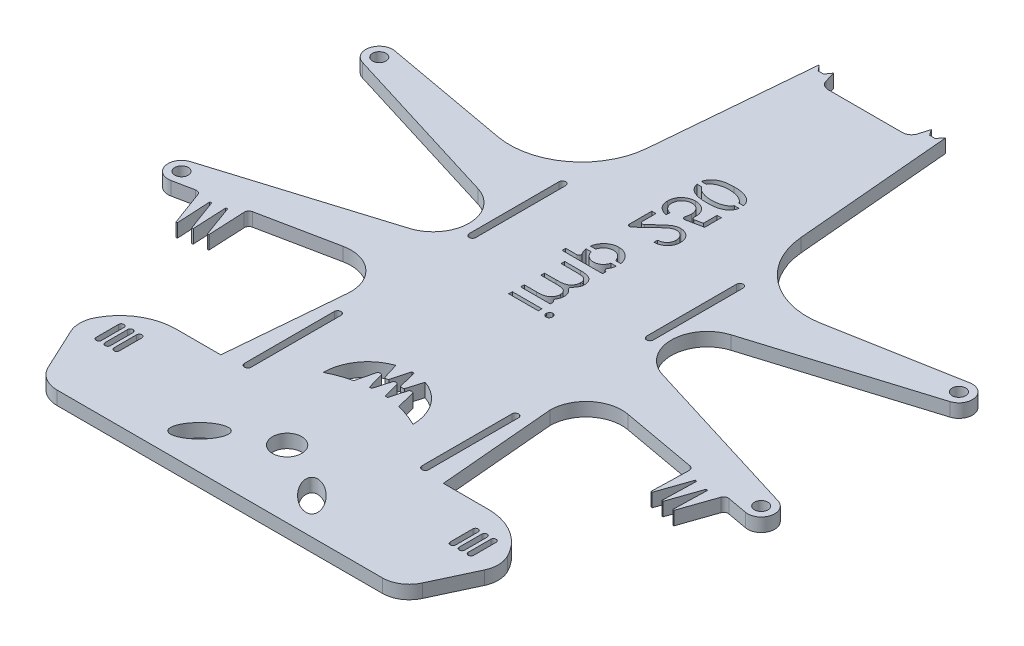
from build123d import *

# Parameters (mm, degrees)
SKETCH_1_R          = 1.5
SKETCH_1_R_2        = 25
SKETCH_1_R_3        = 1
EXTRUDE_1_DEPTH     = 3
CUT_EXTRUDE_1_DEPTH = 3
EXTRUDE_2_DEPTH     = 3
CUT_EXTRUDE_2_DEPTH = 3
SKETCH_6_R          = 3
EXTRUDE_3_DEPTH     = 3
EXTRUDE_4_DEPTH     = 3
CUT_EXTRUDE_3_DEPTH = 10
SKETCH_10_R         = 3.25
EXTRUDE_5_DEPTH     = 3
SKETCH_12_R         = 3.25
SKETCH_12_RX        = 5
SKETCH_12_RY        = 2.25
CUT_EXTRUDE_4_DEPTH = 3
SKETCH_13_W         = 6.576923077
SKETCH_13_H         = 0.807692307
CUT_EXTRUDE_6_DEPTH = 3
EXTRUDE_6_DEPTH     = 3
FILLET_1_R          = 1
FILLET_2_R          = 1
FILLET_3_R          = 1
FILLET_4_R          = 1
FILLET_5_R          = 0.5
FILLET_6_R          = 0.5
FILLET_7_R          = 0.5
FILLET_8_R          = 0.5
FILLET_9_R          = 0.5
FILLET_10_R         = 0.5
FILLET_11_R         = 0.5
FILLET_12_R         = 0.5


with BuildPart() as part:
    # 草图1 → 凸台-拉伸1 (new body)
    with BuildSketch(Plane(origin=(0, 0, 0), x_dir=(1, 0, 0), z_dir=(0, 1, 0))):
        with BuildLine():
            Line((-65.384333619, -19.133302588), (-28.141777015, -7.644526431))
            ThreePointArc((-28.141777015, -7.644526431), (-22.5, 0), (-28.141777015, 7.644526431))
            Line((-28.141777015, 7.644526431), (-65.384333619, 19.133302588))
            ThreePointArc((-65.384333619, 19.133302588), (-67.41435877, 22.711697239), (-63.963475544, 24.951633702))
            Line((-63.963475544, 24.951633702), (-35.956989403, 19.860837807))
            ThreePointArc((-35.956989403, 19.860837807), (-23.387681178, 22.884481961), (-17.156151846, 34.211351583))
            Line((-17.156151846, 34.211351583), (-14.077866308, 69.471713196))
            Line((-14.077866308, 69.471713196), (-13, 68.181117341))
            Line((-13, 68.181117341), (-11.8, 68.181117341))
            Line((-11.8, 68.181117341), (-10.884480237, 69.471713196))
            Line((-10.884480237, 69.471713196), (-10.181933712, 67.110709467))
            ThreePointArc((-10.181933712, 67.110709467), (-9.460655522, 66.077868179), (-8.265, 65.681117341))
            Line((-8.265, 65.681117341), (8.265, 65.681117341))
            ThreePointArc((8.265, 65.681117341), (9.462435388, 66.079197089), (10.183195998, 67.114968849))
            Line((10.183195998, 67.114968849), (10.878780421, 69.471713196))
            Line((10.878780421, 69.471713196), (11.8, 68.181117341))
            Line((11.8, 68.181117341), (13, 68.181117341))
            Line((13, 68.181117341), (14.077866308, 69.471713196))
            Line((14.077866308, 69.471713196), (17.156151846, 34.211351583))
            ThreePointArc((17.156151846, 34.211351583), (23.387681178, 22.884481961), (35.956989403, 19.860837807))
            Line((35.956989403, 19.860837807), (63.963475544, 24.951633702))
            ThreePointArc((63.963475544, 24.951633702), (67.41435877, 22.711697239), (65.384333619, 19.133302588))
            Line((65.384333619, 19.133302588), (28.141777015, 7.644526431))
            ThreePointArc((28.141777015, 7.644526431), (22.5, 0), (28.141777015, -7.644526431))
            Line((28.141777015, -7.644526431), (65.384333619, -19.133302588))
            ThreePointArc((65.384333619, -19.133302588), (67.41435877, -22.711697239), (63.963475544, -24.951633702))
            Line((63.963475544, -24.951633702), (58.589986972, -23.974883765))
            Line((58.589986972, -23.974883765), (55.61845735, -32.558811532))
            ThreePointArc((55.61845735, -32.558811532), (55.466756874, -32.55464441), (55.323293979, -32.505159086))
            Line((55.323293979, -32.505159086), (55.521561464, -24.98413568))
            ThreePointArc((55.521561464, -24.98413568), (55.332251162, -24.907297928), (55.128010304, -24.912599086))
            Line((55.128010304, -24.912599086), (52.666823648, -32.022287076))
            ThreePointArc((52.666823648, -32.022287076), (52.515123172, -32.018119954), (52.371660278, -31.968634631))
            Line((52.371660278, -31.968634631), (52.569927762, -24.447611224))
            ThreePointArc((52.569927762, -24.447611224), (52.38061746, -24.370773472), (52.176376602, -24.37607463))
            Line((52.176376602, -24.37607463), (49.715189946, -31.485762621))
            ThreePointArc((49.715189946, -31.485762621), (49.56348947, -31.481595499), (49.420026576, -31.432110175))
            Line((49.420026576, -31.432110175), (49.659406105, -22.351553934))
            Line((49.659406105, -22.351553934), (31.930731882, -19.128976796))
            ThreePointArc((31.930731882, -19.128976796), (25.373883295, -20.858100658), (22.5, -27))
            Line((22.5, -27), (28, -90))
            Line((28, -90), (28, -109.5))
            ThreePointArc((28, -109.5), (24.924621202, -116.924621202), (17.5, -120))
            Line((17.5, -120), (-17.5, -120))
            ThreePointArc((-17.5, -120), (-24.924621202, -116.924621202), (-28, -109.5))
            Line((-28, -109.5), (-28, -90))
            Line((-28, -90), (-22.5, -27))
            ThreePointArc((-22.5, -27), (-25.142969185, -20.335475151), (-32.064056542, -18.464719321))
            Line((-32.064056542, -18.464719321), (-49.692991602, -22.050022904))
            Line((-49.692991602, -22.050022904), (-49.264522073, -31.123622966))
            ThreePointArc((-49.264522073, -31.123622966), (-49.406923097, -31.17608579), (-49.558503862, -31.183411827))
            Line((-49.558503862, -31.183411827), (-52.129558212, -24.118866271))
            ThreePointArc((-52.129558212, -24.118866271), (-52.333865179, -24.117820464), (-52.52153393, -24.198584753))
            Line((-52.52153393, -24.198584753), (-52.166651557, -31.713846663))
            ThreePointArc((-52.166651557, -31.713846663), (-52.30905258, -31.766309487), (-52.460633345, -31.773635525))
            Line((-52.460633345, -31.773635525), (-55.069376098, -24.716754888))
            ThreePointArc((-55.069376098, -24.716754888), (-55.273683065, -24.715709081), (-55.461351816, -24.79647337))
            Line((-55.461351816, -24.79647337), (-55.06878104, -32.304070361))
            ThreePointArc((-55.06878104, -32.304070361), (-55.211182063, -32.356533185), (-55.362762829, -32.363859222))
            Line((-55.362762829, -32.363859222), (-58.512445259, -23.843688755))
            Line((-58.512445259, -23.843688755), (-63.902111383, -24.939817886))
            ThreePointArc((-63.902111383, -24.939817886), (-67.406788203, -22.742012359), (-65.384333619, -19.133302588))
        make_face()
        with Locations(Location((-64.5, 22, 0), (0, 0, 270))):
            Circle(SKETCH_1_R, mode=Mode.SUBTRACT)
        with Locations(Location((64.5, 22, 0), (0, 0, 90))):
            Circle(SKETCH_1_R, mode=Mode.SUBTRACT)
        with Locations(Location((64.5, -22, 0), (0, 0, 270))):
            Circle(SKETCH_1_R, mode=Mode.SUBTRACT)
        with Locations(Location((-64.5, -22, 0), (0, 0, 90))):
            Circle(SKETCH_1_R, mode=Mode.SUBTRACT)
        with Locations(Location((0, -90, 0), (0, 0, 270))):
            Circle(SKETCH_1_R_2, mode=Mode.SUBTRACT)
        with Locations(Location((-15, -65, 0), (0, 0, 270))):
            Circle(SKETCH_1_R_3, mode=Mode.SUBTRACT)
        with Locations(Location((15, -65, 0), (0, 0, 270))):
            Circle(SKETCH_1_R_3, mode=Mode.SUBTRACT)
        with Locations(Location((-15.42, -115, 0), (0, 0, 270))):
            Circle(SKETCH_1_R_3, mode=Mode.SUBTRACT)
        with Locations(Location((17.43, -115, 0), (0, 0, 270))):
            Circle(SKETCH_1_R_3, mode=Mode.SUBTRACT)
    extrude(amount=EXTRUDE_1_DEPTH)

    # 草图2 → 切除-拉伸1 (cut)
    with BuildSketch(Plane.XZ):
        with BuildLine():
            Line((-19, 2), (-19, -18))
            ThreePointArc((-19, -18), (-19.75, -18.75), (-20.5, -18))
            Line((-20.5, -18), (-20.5, 2))
            ThreePointArc((-20.5, 2), (-19.75, 2.75), (-19, 2))
        make_face()
        with BuildLine():
            Line((20.5, 2), (20.5, -18))
            ThreePointArc((20.5, -18), (19.75, -18.75), (19, -18))
            Line((19, -18), (19, 2))
            ThreePointArc((19, 2), (19.75, 2.75), (20.5, 2))
        make_face()
        with BuildLine():
            Line((-19, 52), (-19, 32))
            ThreePointArc((-19, 32), (-19.75, 31.25), (-20.5, 32))
            Line((-20.5, 32), (-20.5, 52))
            ThreePointArc((-20.5, 52), (-19.75, 52.75), (-19, 52))
        make_face()
        with BuildLine():
            Line((20.5, 52), (20.5, 32))
            ThreePointArc((20.5, 32), (19.75, 31.25), (19, 32))
            Line((19, 32), (19, 52))
            ThreePointArc((19, 52), (19.75, 52.75), (20.5, 52))
        make_face()
        with BuildLine():
            ThreePointArc((-10, 45), (0, 35), (10, 45))
            ThreePointArc((10, 45), (0, 42.595917942), (-10, 45))
        make_face()
    extrude(amount=-CUT_EXTRUDE_1_DEPTH, mode=Mode.SUBTRACT)

    # 草图3 → 凸台-拉伸2 (add)
    with BuildSketch(Plane.XZ):
        with BuildLine():
            Line((-1.5, 42.647113875), (-0.445421149, 38.96))
            ThreePointArc((-0.445421149, 38.96), (0, 38.8), (0.445421149, 38.96))
            Line((0.445421149, 38.96), (1.5, 42.647113875))
            Line((1.5, 42.647113875), (1.5, 43.687015642))
            Line((1.5, 43.687015642), (2, 43.687015642))
            Line((2, 43.687015642), (2, 42.687015642))
            Line((2, 42.687015642), (3.054578851, 38.96))
            ThreePointArc((3.054578851, 38.96), (3.5, 38.8), (3.945421149, 38.96))
            Line((3.945421149, 38.96), (5, 43.171632657))
            Line((5, 43.171632657), (5, 44.171632657))
            Line((5, 44.171632657), (-5, 44.171632657))
            Line((-5, 44.171632657), (-5, 43.171632657))
            Line((-5, 43.171632657), (-3.945421149, 38.96))
            ThreePointArc((-3.945421149, 38.96), (-3.5, 38.8), (-3.054578851, 38.96))
            Line((-3.054578851, 38.96), (-2, 42.687015642))
            Line((-2, 42.687015642), (-2, 43.687015642))
            Line((-2, 43.687015642), (-1.5, 43.687015642))
            Line((-1.5, 43.687015642), (-1.5, 42.647113875))
        make_face()
        with BuildLine():
            Line((-1.304578851, 39.04), (-0.25, 35.003125488))
            Line((-0.25, 35.003125488), (-0.25, 34.003125488))
            Line((-0.25, 34.003125488), (0.25, 34.003125488))
            Line((0.25, 34.003125488), (0.25, 35.003125488))
            Line((0.25, 35.003125488), (1.304578851, 39.04))
            ThreePointArc((1.304578851, 39.04), (1.75, 39.2), (2.195421149, 39.04))
            Line((2.195421149, 39.04), (3.25, 35.54285984))
            Line((3.25, 35.54285984), (3.25, 33.54285984))
            Line((3.25, 33.54285984), (-3.25, 33.54285984))
            Line((-3.25, 33.54285984), (-3.25, 35.54285984))
            Line((-3.25, 35.54285984), (-2.190592727, 39.043946734))
            ThreePointArc((-2.190592727, 39.043946734), (-1.746881893, 39.199993055), (-1.304578851, 39.04))
        make_face()
    extrude(amount=-EXTRUDE_2_DEPTH)

    # 草图4 → 切除-拉伸2 (cut)
    with BuildSketch(Plane.XZ):
        with BuildLine():
            Line((-28, 108), (-21.44761059, 108))
            ThreePointArc((-21.44761059, 108), (-26.31095871, 99.57775818), (-28, 90))
            Line((-28, 90), (-28, 108))
        make_face()
        with BuildLine():
            Line((-21.44761059, 113), (-21.44761059, 119.229664467))
            ThreePointArc((-21.44761059, 119.229664467), (-25.091953813, 116.753429347), (-27.399494937, 113))
            Line((-27.399494937, 113), (-21.44761059, 113))
        make_face()
        with BuildLine():
            Line((21.44761059, 119.229664467), (21.44761059, 113))
            Line((21.44761059, 113), (27.399494937, 113))
            ThreePointArc((27.399494937, 113), (25.091953813, 116.753429347), (21.44761059, 119.229664467))
        make_face()
        with BuildLine():
            Line((21.44761059, 108), (28, 108))
            Line((28, 108), (28, 90))
            ThreePointArc((28, 90), (26.31095871, 99.57775818), (21.44761059, 108))
        make_face()
    extrude(amount=-CUT_EXTRUDE_2_DEPTH, mode=Mode.SUBTRACT)

    # 草图6 → 凸台-拉伸3 (add)
    with BuildSketch(Plane.XZ):
        Polygon((-21.44761059, 119.229664467), (-21.44761059, 139), (-18.44761059, 142), (18.44761059, 142), (21.44761059, 139), (21.44761059, 119.229664467), align=None)
        with Locations(Location((0, 131, 0), (0, 0, 270))):
            Circle(SKETCH_6_R, mode=Mode.SUBTRACT)
    extrude(amount=-EXTRUDE_3_DEPTH)

    # 草图7 → 凸台-拉伸4 (add)
    with BuildSketch(Plane.XZ):
        with BuildLine():
            Line((-26.611915935, 74.100127979), (-28, 90))
            ThreePointArc((-28, 90), (-26.31095871, 99.57775818), (-21.44761059, 108))
            Line((-21.44761059, 108), (-25.238858928, 108))
            ThreePointArc((-25.238858928, 108), (-30.974603213, 91.254573939), (-26.611915935, 74.100127979))
        make_face()
        with BuildLine():
            Line((28, 90), (26.611915935, 74.100127979))
            ThreePointArc((26.611915935, 74.100127979), (30.974603213, 91.254573939), (25.238858928, 108))
            Line((25.238858928, 108), (21.44761059, 108))
            ThreePointArc((21.44761059, 108), (26.31095871, 99.57775818), (28, 90))
        make_face()
    extrude(amount=-EXTRUDE_4_DEPTH)

    # 草图8 → 切除-拉伸3 (cut)
    with BuildSketch(Plane.XZ):
        with BuildLine():
            Line((-25.642857143, 63), (-26.611915935, 74.100127979))
            ThreePointArc((-26.611915935, 74.100127979), (-30.974603213, 91.254573939), (-25.238858928, 108))
            Line((-25.238858928, 108), (-28, 108))
            Line((-28, 108), (-28, 109.5))
            ThreePointArc((-28, 109.5), (-27.848784876, 111.275570777), (-27.399494937, 113))
            Line((-27.399494937, 113), (-21.44761059, 113))
            Line((-21.44761059, 113), (-21.44761059, 139))
            Line((-21.44761059, 139), (-18.44761059, 142))
            Line((-18.44761059, 142), (18.44761059, 142))
            Line((18.44761059, 142), (21.44761059, 139))
            Line((21.44761059, 139), (21.44761059, 113))
            Line((21.44761059, 113), (27.399494937, 113))
            ThreePointArc((27.399494937, 113), (27.848784876, 111.275570777), (28, 109.5))
            Line((28, 109.5), (28, 108))
            Line((28, 108), (25.238858928, 108))
            ThreePointArc((25.238858928, 108), (30.974603213, 91.254573939), (26.611915935, 74.100127979))
            Line((26.611915935, 74.100127979), (25.642857143, 63))
            Line((25.642857143, 63), (-25.642857143, 63))
        make_face()
    extrude(amount=-CUT_EXTRUDE_3_DEPTH, mode=Mode.SUBTRACT)

    # 草图10 → 凸台-拉伸5 (add)
    with BuildSketch(Plane.XZ):
        with BuildLine():
            Line((-36.178256522, 78), (36.179387073, 78))
            ThreePointArc((36.179387073, 78), (39.402099477, 77.061039889), (41.616145749, 74.538041587))
            Line((41.616145749, 74.538041587), (46.006583576, 65.133250478))
            ThreePointArc((46.006583576, 65.133250478), (46.569297198, 62.515634135), (45.937355577, 59.913863253))
            ThreePointArc((45.937355577, 59.913863253), (41.328556521, 54.868050288), (34.755, 53))
            Line((34.755, 53), (-34.750102572, 53))
            ThreePointArc((-34.750102572, 53), (-41.324318007, 54.868457712), (-45.933150477, 59.915249373))
            ThreePointArc((-45.933150477, 59.915249373), (-46.56475403, 62.515922491), (-46.002726431, 65.132513534))
            Line((-46.002726431, 65.132513534), (-41.615695471, 74.53658386))
            ThreePointArc((-41.615695471, 74.53658386), (-39.401647348, 77.060607827), (-36.178256522, 78))
        make_face()
        with Locations((0, 63)):
            Circle(SKETCH_10_R, mode=Mode.SUBTRACT)
    extrude(amount=-EXTRUDE_5_DEPTH)

    # 草图12 → 切除-拉伸4 (cut)
    with BuildSketch(Plane.XZ):
        with Locations(Location((0, 63, 0), (0, 0, 270))):
            Circle(SKETCH_12_R)
        with Locations(Location((-12.5, 70), (0, 0, -45))):
            Ellipse(SKETCH_12_RX, SKETCH_12_RY)
        with Locations(Location((12.5, 70), (0, 0, -135))):
            Ellipse(SKETCH_12_RX, SKETCH_12_RY)
        with BuildLine():
            Line((-40.812006362, 63.5), (-40.812006362, 58.5))
            ThreePointArc((-40.812006362, 58.5), (-41.412006362, 57.9), (-42.012006362, 58.5))
            Line((-42.012006362, 58.5), (-42.012006362, 63.5))
            ThreePointArc((-42.012006362, 63.5), (-41.412006362, 64.1), (-40.812006362, 63.5))
        make_face()
        with BuildLine():
            Line((-38.812006362, 63.5), (-38.812006362, 58.5))
            ThreePointArc((-38.812006362, 58.5), (-39.412006362, 57.9), (-40.012006362, 58.5))
            Line((-40.012006362, 58.5), (-40.012006362, 63.5))
            ThreePointArc((-40.012006362, 63.5), (-39.412006362, 64.1), (-38.812006362, 63.5))
        make_face()
        with BuildLine():
            Line((-36.812006362, 63.5), (-36.812006362, 58.5))
            ThreePointArc((-36.812006362, 58.5), (-37.412006362, 57.9), (-38.012006362, 58.5))
            Line((-38.012006362, 58.5), (-38.012006362, 63.5))
            ThreePointArc((-38.012006362, 63.5), (-37.412006362, 64.1), (-36.812006362, 63.5))
        make_face()
        with BuildLine():
            Line((36.812006362, 63.5), (36.812006362, 58.5))
            ThreePointArc((36.812006362, 58.5), (37.412006362, 57.9), (38.012006362, 58.5))
            Line((38.012006362, 58.5), (38.012006362, 63.5))
            ThreePointArc((38.012006362, 63.5), (37.412006362, 64.1), (36.812006362, 63.5))
        make_face()
        with BuildLine():
            Line((38.812006362, 63.5), (38.812006362, 58.5))
            ThreePointArc((38.812006362, 58.5), (39.412006362, 57.9), (40.012006362, 58.5))
            Line((40.012006362, 58.5), (40.012006362, 63.5))
            ThreePointArc((40.012006362, 63.5), (39.412006362, 64.1), (38.812006362, 63.5))
        make_face()
        with BuildLine():
            Line((40.812006362, 63.5), (40.812006362, 58.5))
            ThreePointArc((40.812006362, 58.5), (41.412006362, 57.9), (42.012006362, 58.5))
            Line((42.012006362, 58.5), (42.012006362, 63.5))
            ThreePointArc((42.012006362, 63.5), (41.412006362, 64.1), (40.812006362, 63.5))
        make_face()
    extrude(amount=-CUT_EXTRUDE_4_DEPTH, mode=Mode.SUBTRACT)

    # 草图13 → 切除-拉伸6 (cut)
    # profile 1 of 7: a face of its own
    with BuildSketch(Plane.XZ):
        with BuildLine():
            add(Edge.make_bspline(
                [(4.846153846, 8.792067308), (4.843818798, 8.74195515), (4.839246325, 8.64382592), (4.800402917, 8.501781509), (4.733556643, 8.372570318), (4.64678855, 8.256252798), (4.540549673, 8.15983092), (4.419838827, 8.090691302), (4.288426277, 8.046552781), (4.196860813, 8.041191319), (4.150240385, 8.038461538)],
                knots=[0, 0, 0, 0, 1.054986045, 2.065865298, 3.074122704, 4.105114675, 5.109626121, 6.074217918, 7.019490725, 8, 8, 8, 8], degree=3))
            add(Edge.make_bspline(
                [(4.150240385, 8.038461538), (4.104830077, 8.041252386), (4.015059273, 8.046769563), (3.885925251, 8.090658674), (3.766895276, 8.160410574), (3.660864105, 8.25618862), (3.574146137, 8.372587268), (3.50728662, 8.501777025), (3.468446712, 8.6438271), (3.463873756, 8.741955549), (3.461538462, 8.792067308)],
                knots=[0, 0, 0, 0, 0.961106377, 1.899993565, 2.859409042, 3.870007927, 4.90724781, 5.921615355, 6.938620636, 8, 8, 8, 8], degree=3))
            add(Edge.make_bspline(
                [(3.461538462, 8.792067308), (3.463798755, 8.841603522), (3.46819812, 8.93801929), (3.507751305, 9.077451923), (3.574000746, 9.20458406), (3.662064165, 9.318999353), (3.766190239, 9.416676335), (3.886015162, 9.486170871), (4.015036381, 9.530177328), (4.104822387, 9.53567869), (4.150240385, 9.538461538)],
                knots=[0, 0, 0, 0, 1.055304112, 2.054011575, 3.063363921, 4.096942562, 5.122536081, 6.088009498, 7.032825006, 8, 8, 8, 8], degree=3))
            add(Edge.make_bspline(
                [(4.150240385, 9.538461538), (4.196868795, 9.535740055), (4.288449936, 9.530394888), (4.419747377, 9.486136715), (4.541260725, 9.41726314), (4.645589359, 9.31893624), (4.733701715, 9.204600582), (4.799938358, 9.077447621), (4.839494889, 8.938020432), (4.843893791, 8.841603909), (4.846153846, 8.792067308)],
                knots=[0, 0, 0, 0, 0.986662878, 1.937868148, 2.908513651, 3.927890639, 4.955204348, 5.958438607, 6.951092507, 8, 8, 8, 8], degree=3))
        make_face()
    # profile 2 of 7: a face of its own
    with BuildSketch(Plane.XZ):
        with Locations((-1.211538461, 8.788461539)):
            Rectangle(SKETCH_13_W, SKETCH_13_H)
    # profile 3 of 7: a face of its own
    with BuildSketch(Plane.XZ):
        with BuildLine():
            Line((2.076923077, 6.538461538), (2.076923077, 5.730769231))
            Line((2.076923077, 5.730769231), (0.933894231, 5.730769231))
            add(Edge.make_bspline(
                [(0.933894231, 5.730769231), (1.033742974, 5.657881315), (1.224738575, 5.518457714), (1.479228692, 5.292022882), (1.69165173, 5.0619223), (1.804623222, 4.897379969), (1.858774038, 4.818509615)],
                knots=[0, 0, 0, 0, 1.134266299, 2.169680534, 3.122669868, 4, 4, 4, 4], degree=3))
            add(Edge.make_bspline(
                [(1.858774038, 4.818509615), (1.910216406, 4.710857627), (2.012202383, 4.497434456), (2.115660106, 4.159499306), (2.179238938, 3.813707299), (2.187933899, 3.580200463), (2.192307692, 3.462740385)],
                knots=[0, 0, 0, 0, 1.014936303, 2.012140481, 3.000054389, 4, 4, 4, 4], degree=3))
            add(Edge.make_bspline(
                [(2.192307692, 3.462740385), (2.189612669, 3.383304144), (2.184279362, 3.226104095), (2.149771973, 2.993131341), (2.089405815, 2.766824926), (2.00745445, 2.548652805), (1.905036614, 2.344346974), (1.787267943, 2.15668963), (1.654240978, 1.987985139), (1.500804814, 1.838506787), (1.322503942, 1.70410393), (1.114569371, 1.580471628), (0.872320469, 1.466235667), (0.696520886, 1.402923685), (0.603966346, 1.369591346)],
                knots=[0, 0, 0, 0, 1.009798505, 1.998336943, 2.985959917, 3.981996858, 4.955664737, 5.886087062, 6.794002107, 7.679958053, 8.601272429, 9.625787331, 10.750030247, 12, 12, 12, 12], degree=3))
            add(Edge.make_bspline(
                [(0.603966346, 1.369591346), (0.667543423, 1.334333842), (0.792654183, 1.264952026), (0.969718298, 1.148451821), (1.135335719, 1.026391757), (1.28963811, 0.897731688), (1.431862564, 0.762925406), (1.562482648, 0.621339677), (1.682047096, 0.473776136), (1.821771796, 0.268609079), (1.969604653, 0.002059329), (2.099444708, -0.334101325), (2.178013836, -0.68448705), (2.187519457, -0.922682741), (2.192307692, -1.042668269)],
                knots=[0, 0, 0, 0, 0.861170869, 1.694663331, 2.509326413, 3.297991968, 4.073691563, 4.829592376, 5.579160782, 6.321830913, 7.768780219, 9.179854006, 10.579417172, 12, 12, 12, 12], degree=3))
            add(Edge.make_bspline(
                [(2.192307692, -1.042668269), (2.188149124, -1.152934888), (2.180010403, -1.368737367), (2.116101472, -1.682907479), (2.006358951, -1.975900692), (1.856615314, -2.24712746), (1.668440271, -2.491824123), (1.444548974, -2.704523203), (1.186525086, -2.883932709), (0.94380283, -3.001134925), (0.729511974, -3.080631319), (0.546924368, -3.129645922), (0.345963232, -3.172947995), (0.126388273, -3.208899768), (-0.112576148, -3.235176045), (-0.370538972, -3.254643599), (-0.647700687, -3.267819788), (-0.838926259, -3.268750831), (-0.9375, -3.269230769)],
                knots=[0, 0, 0, 0, 1.209669288, 2.367440248, 3.500751976, 4.631527125, 5.755587489, 6.87532382, 8.007944318, 9.190864318, 9.82315674, 10.514484317, 11.263564316, 12.079023757, 12.955305781, 13.901327259, 14.918167583, 16, 16, 16, 16], degree=3))
            Line((-0.9375, -3.269230769), (-4.5, -3.269230769))
            Line((-4.5, -3.269230769), (-4.5, -2.461538462))
            Line((-4.5, -2.461538462), (-0.933894231, -2.461538462))
            add(Edge.make_bspline(
                [(-0.933894231, -2.461538462), (-0.849755612, -2.461338191), (-0.688053983, -2.460953301), (-0.455976251, -2.454026821), (-0.244429049, -2.440976012), (-0.053700814, -2.425715516), (0.116653189, -2.404517137), (0.266290913, -2.377141922), (0.39638905, -2.348142056), (0.540611243, -2.299964256), (0.699699836, -2.222952285), (0.871300119, -2.105662839), (1.02055523, -1.957834963), (1.150897454, -1.786958546), (1.254736027, -1.591932037), (1.331698502, -1.377888313), (1.377195036, -1.145549299), (1.382100303, -0.984578135), (1.384615385, -0.902043269)],
                knots=[0, 0, 0, 0, 1.253542879, 2.409118771, 3.458568974, 4.411070626, 5.259544058, 6.014735414, 6.677123945, 7.243402448, 8.276608576, 9.299873988, 10.325604302, 11.392892819, 12.490509435, 13.603538441, 14.771260462, 16, 16, 16, 16], degree=3))
            add(Edge.make_bspline(
                [(1.384615385, -0.902043269), (1.380894536, -0.800056069), (1.373519347, -0.597904631), (1.301016616, -0.303301015), (1.188991101, -0.020967437), (1.02904829, 0.241506908), (0.836601053, 0.483261936), (0.607895441, 0.691297547), (0.349126813, 0.86314953), (0.109608212, 0.979517449), (-0.105542006, 1.053032714), (-0.293506624, 1.101573374), (-0.507144958, 1.13933066), (-0.745021358, 1.174740594), (-1.008773252, 1.197851894), (-1.297180568, 1.21885628), (-1.61111075, 1.228681356), (-1.828722235, 1.230055679), (-1.941706731, 1.230769231)],
                knots=[0, 0, 0, 0, 1.090512009, 2.161531735, 3.230072964, 4.332825141, 5.440581378, 6.529496625, 7.62916386, 8.757669174, 9.370357692, 10.061947597, 10.834545503, 11.692923569, 12.636967211, 13.669242667, 14.789864225, 16, 16, 16, 16], degree=3))
            Line((-1.941706731, 1.230769231), (-4.5, 1.230769231))
            Line((-4.5, 1.230769231), (-4.5, 2.038461538))
            Line((-4.5, 2.038461538), (-1.155649038, 2.038461538))
            add(Edge.make_bspline(
                [(-1.155649038, 2.038461538), (-1.061293722, 2.038656638), (-0.879763577, 2.039031989), (-0.619462476, 2.046034454), (-0.382636355, 2.058718461), (-0.169879859, 2.075100892), (0.019385173, 2.092881426), (0.184537886, 2.121019606), (0.326265509, 2.150350859), (0.483210616, 2.195113029), (0.653458084, 2.272644658), (0.836337212, 2.390578591), (0.997508567, 2.537085414), (1.134181048, 2.711151922), (1.246209191, 2.90770771), (1.328173644, 3.123959098), (1.375449135, 3.35853991), (1.381502347, 3.52021787), (1.384615385, 3.603365385)],
                knots=[0, 0, 0, 0, 1.320226356, 2.539982809, 3.643122147, 4.638255983, 5.52602392, 6.301561104, 6.98107216, 7.550523949, 8.58191082, 9.584830316, 10.584890324, 11.614493144, 12.668965657, 13.738783174, 14.837104585, 16, 16, 16, 16], degree=3))
            add(Edge.make_bspline(
                [(1.384615385, 3.603365385), (1.380679916, 3.701121356), (1.372836666, 3.895945536), (1.302239964, 4.182150611), (1.191658051, 4.45854233), (1.038247111, 4.720711708), (0.848220821, 4.961587511), (0.624725702, 5.172468056), (0.370541236, 5.349740743), (0.133550789, 5.467363164), (-0.07621797, 5.54315809), (-0.25451744, 5.593752449), (-0.452748196, 5.636180793), (-0.670476501, 5.672143861), (-0.908154253, 5.699205558), (-1.165109732, 5.715396418), (-1.442154492, 5.729628413), (-1.63339168, 5.73037963), (-1.732572115, 5.730769231)],
                knots=[0, 0, 0, 0, 1.098813768, 2.189896819, 3.297771711, 4.440532809, 5.596253211, 6.739894833, 7.8864334, 9.072265856, 9.705655743, 10.395080422, 11.156654178, 11.986235968, 12.878145268, 13.847797945, 14.883813667, 16, 16, 16, 16], degree=3))
            Line((-1.732572115, 5.730769231), (-4.5, 5.730769231))
            Line((-4.5, 5.730769231), (-4.5, 6.538461538))
            Line((-4.5, 6.538461538), (2.076923077, 6.538461538))
        make_face()
    # profile 4 of 7: a face of its own
    with BuildSketch(Plane.XZ):
        with BuildLine():
            Line((2.076923077, -5.115384615), (2.076923077, -5.923076923))
            Line((2.076923077, -5.923076923), (0.859975962, -5.923076923))
            add(Edge.make_bspline(
                [(0.859975962, -5.923076923), (0.970359751, -6.008874699), (1.184868556, -6.175605508), (1.463270703, -6.462948271), (1.696332344, -6.767680508), (1.879988256, -7.094403408), (2.019163824, -7.439180705), (2.121010224, -7.801663068), (2.18136845, -8.184876117), (2.188613033, -8.446899657), (2.192307692, -8.580528846)],
                knots=[0, 0, 0, 0, 1.082960489, 2.104516986, 3.092433479, 4.050182639, 5.001196938, 5.969027827, 6.964226023, 8, 8, 8, 8], degree=3))
            add(Edge.make_bspline(
                [(2.192307692, -8.580528846), (2.188930947, -8.697250112), (2.182256631, -8.927955824), (2.137068777, -9.267546984), (2.059623282, -9.594569399), (1.948020928, -9.907172967), (1.81004972, -10.208706563), (1.6359202, -10.494706248), (1.43430428, -10.76962682), (1.20227875, -11.026554163), (0.951234636, -11.263951965), (0.681177283, -11.469270717), (0.400987775, -11.646369899), (0.106322395, -11.78952209), (-0.200498482, -11.901657841), (-0.520714473, -11.981409869), (-0.85313832, -12.028872381), (-1.079173887, -12.035240399), (-1.193509615, -12.038461538)],
                knots=[0, 0, 0, 0, 1.041296284, 2.058176809, 3.050446431, 4.034000596, 5.01514041, 6.003636468, 7.015969324, 8.052561599, 9.08815499, 10.094063707, 11.074456064, 12.040834395, 13.011057502, 13.983766392, 14.980127149, 16, 16, 16, 16], degree=3))
            add(Edge.make_bspline(
                [(-1.193509615, -12.038461538), (-1.310265089, -12.035327807), (-1.540523731, -12.029147636), (-1.878537512, -11.980694712), (-2.204340673, -11.904541074), (-2.51483261, -11.790392758), (-2.814505623, -11.650636628), (-3.098295204, -11.47577163), (-3.368906796, -11.270598141), (-3.621775544, -11.035751398), (-3.854782202, -10.781075307), (-4.05843193, -10.508767657), (-4.23019385, -10.222891387), (-4.371664742, -9.924813036), (-4.4807012, -9.613491193), (-4.557890097, -9.289093735), (-4.605911378, -8.951550356), (-4.612202655, -8.721913447), (-4.615384615, -8.605769231)],
                knots=[0, 0, 0, 0, 1.038787011, 2.048637893, 3.033314735, 4.011256821, 4.987456671, 5.971770257, 6.972013799, 8.005388554, 9.039095487, 10.040396776, 11.026510796, 12.002710647, 12.972028308, 13.95670515, 14.966556032, 16, 16, 16, 16], degree=3))
            add(Edge.make_bspline(
                [(-4.615384615, -8.605769231), (-4.612154357, -8.474450735), (-4.60580266, -8.216237518), (-4.538195215, -7.838390498), (-4.440128143, -7.475185608), (-4.292275724, -7.130459686), (-4.108931647, -6.800045028), (-3.879675596, -6.489181834), (-3.615451457, -6.190933525), (-3.4119492, -6.013469843), (-3.308293269, -5.923076923)],
                knots=[0, 0, 0, 0, 1.019281043, 2.00422519, 2.974076634, 3.936751752, 4.91100001, 5.903882226, 6.932321223, 8, 8, 8, 8], degree=3))
            Line((-3.308293269, -5.923076923), (-6.923076923, -5.923076923))
            Line((-6.923076923, -5.923076923), (-6.923076923, -5.115384615))
            Line((-6.923076923, -5.115384615), (2.076923077, -5.115384615))
        make_face()
        with BuildLine():
            add(Edge.make_bspline(
                [(1.384615385, -8.573317308), (1.382966554, -8.481828222), (1.379720432, -8.301709794), (1.341251035, -8.037678113), (1.285225537, -7.783439376), (1.201244866, -7.541695945), (1.095710168, -7.310480707), (0.968196181, -7.089392501), (0.812973847, -6.882149396), (0.63907723, -6.686296018), (0.448423619, -6.507369085), (0.24308679, -6.350755072), (0.025894264, -6.218975102), (-0.202024347, -6.1097118), (-0.442305548, -6.026535934), (-0.693620843, -5.96750898), (-0.95623446, -5.930401801), (-1.135092831, -5.925544611), (-1.225961538, -5.923076923)],
                knots=[0, 0, 0, 0, 1.056783697, 2.080534709, 3.078213817, 4.062450963, 5.032388505, 6.013014931, 7.006476528, 8.020136409, 9.037574406, 10.02408906, 10.99988041, 11.969394914, 12.94050107, 13.932990591, 14.949859205, 16, 16, 16, 16], degree=3))
            add(Edge.make_bspline(
                [(-1.225961538, -5.923076923), (-1.345227054, -5.927221022), (-1.578878299, -5.935339664), (-1.920769066, -5.999772926), (-2.243087789, -6.108706779), (-2.545661922, -6.258423259), (-2.822528544, -6.448980177), (-3.072436426, -6.676056941), (-3.289761677, -6.942235743), (-3.473541751, -7.240555118), (-3.622619769, -7.560535623), (-3.729379561, -7.89426088), (-3.795134392, -8.237201727), (-3.803483669, -8.469062773), (-3.807692308, -8.5859375)],
                knots=[0, 0, 0, 0, 1.037446521, 2.0324456, 3.014856775, 3.990198243, 4.96070402, 5.930645943, 6.919052903, 7.940784962, 8.972706292, 9.9832942, 10.983434506, 12, 12, 12, 12], degree=3))
            add(Edge.make_bspline(
                [(-3.807692308, -8.5859375), (-3.803690163, -8.700458), (-3.795746625, -8.927760605), (-3.726991769, -9.262453597), (-3.621959856, -9.587712638), (-3.468813745, -9.896757257), (-3.281098681, -10.18683776), (-3.056041715, -10.448955838), (-2.794446803, -10.677537372), (-2.504938628, -10.874728602), (-2.193126304, -11.03220898), (-1.870015482, -11.147614166), (-1.538351251, -11.216401718), (-1.314612893, -11.225973794), (-1.202524038, -11.230769231)],
                knots=[0, 0, 0, 0, 1.000942316, 1.986690553, 2.977613063, 3.984008645, 4.994597959, 5.993715906, 6.995776077, 8.025307715, 9.050480445, 10.043228463, 11.019692995, 12, 12, 12, 12], degree=3))
            add(Edge.make_bspline(
                [(-1.202524038, -11.230769231), (-1.089761318, -11.22701508), (-0.865114411, -11.219536027), (-0.533901612, -11.146329391), (-0.210867343, -11.035328452), (0.098162034, -10.877467174), (0.386424604, -10.683817352), (0.643148355, -10.453564691), (0.867174769, -10.194638109), (1.05239152, -9.904919838), (1.199687838, -9.593915647), (1.30739108, -9.266538296), (1.372122925, -8.924425148), (1.380414602, -8.691382748), (1.384615385, -8.573317308)],
                knots=[0, 0, 0, 0, 0.983883291, 1.96010114, 2.949781603, 3.961842304, 4.982704228, 5.97556912, 6.965945748, 7.965066277, 8.970293822, 9.964878779, 10.968953791, 12, 12, 12, 12], degree=3))
        make_face(mode=Mode.SUBTRACT)
    # profile 5 of 7: a face of its own
    with BuildSketch(Plane.XZ):
        with BuildLine():
            Line((1.730769231, -17.692307692), (1.730769231, -16.884615385))
            add(Edge.make_bspline(
                [(1.730769231, -16.884615385), (1.83792347, -16.889878596), (2.048371545, -16.900215404), (2.355196973, -16.948643684), (2.648507792, -17.017874338), (2.925789399, -17.115990327), (3.190354156, -17.237154999), (3.438688949, -17.385495621), (3.673258472, -17.557849812), (3.889621546, -17.75390138), (4.087404447, -17.9666354), (4.260007513, -18.194777266), (4.404171703, -18.435982108), (4.525345028, -18.688157821), (4.616189885, -18.95422089), (4.683624885, -19.23162805), (4.724190469, -19.521633154), (4.728551359, -19.71922156), (4.730769231, -19.819711538)],
                knots=[0, 0, 0, 0, 1.100776268, 2.161895295, 3.184016182, 4.190939212, 5.176500551, 6.166955529, 7.155448256, 8.160289653, 9.16017456, 10.133824356, 11.091467644, 12.04088621, 13.000931625, 13.972173743, 14.968683325, 16, 16, 16, 16], degree=3))
            add(Edge.make_bspline(
                [(4.730769231, -19.819711538), (4.728458914, -19.918398015), (4.723919225, -20.112313415), (4.684933721, -20.395330024), (4.623873628, -20.664757352), (4.538205415, -20.920068752), (4.423045459, -21.159227204), (4.284708931, -21.384029318), (4.124715078, -21.597151403), (3.93634813, -21.788997418), (3.735256284, -21.965161051), (3.520573103, -22.117138278), (3.298840654, -22.247286413), (3.068368136, -22.355769018), (2.826985491, -22.435627661), (2.57820697, -22.496257339), (2.319457456, -22.530527831), (2.144326313, -22.535787492), (2.055288462, -22.538461538)],
                knots=[0, 0, 0, 0, 1.111607364, 2.184268762, 3.212621178, 4.221274766, 5.211760367, 6.196651075, 7.1921475, 8.207485113, 9.220403448, 10.201281604, 11.166441695, 12.114753415, 13.065576456, 14.026450734, 14.996634279, 16, 16, 16, 16], degree=3))
            add(Edge.make_bspline(
                [(2.055288462, -22.538461538), (1.929936887, -22.534107434), (1.68143348, -22.525475633), (1.316252405, -22.451638665), (0.962440756, -22.336319065), (0.677687693, -22.197468719), (0.448230138, -22.05739672), (0.259310611, -21.9311717), (0.055896549, -21.783405043), (-0.16133089, -21.611946049), (-0.394073217, -21.42034152), (-0.642189834, -21.206855957), (-0.903117242, -20.969967004), (-1.081331646, -20.803702287), (-1.173677885, -20.717548077)],
                knots=[0, 0, 0, 0, 1.184426356, 2.348067706, 3.509069118, 4.696110526, 5.333549288, 6.050745305, 6.844228056, 7.710549037, 8.667450064, 9.695053472, 10.805634456, 12, 12, 12, 12], degree=3))
            Line((-1.173677885, -20.717548077), (-3.576923077, -18.465745192))
            Line((-3.576923077, -18.465745192), (-3.576923077, -22.653846154))
            Line((-3.576923077, -22.653846154), (-4.5, -22.653846154))
            Line((-4.5, -22.653846154), (-4.5, -16.538461538))
            Line((-4.5, -16.538461538), (-0.775240385, -20.028846154))
            add(Edge.make_bspline(
                [(-0.775240385, -20.028846154), (-0.686535292, -20.113832451), (-0.516150963, -20.277073734), (-0.267319695, -20.507864061), (-0.036746545, -20.715484314), (0.17659021, -20.900072217), (0.371481151, -21.06177965), (0.549453591, -21.200089221), (0.708980225, -21.315612232), (0.896385443, -21.43804255), (1.125467664, -21.554787983), (1.404009935, -21.657395272), (1.691381461, -21.719512329), (1.885519819, -21.727001908), (1.983173077, -21.730769231)],
                knots=[0, 0, 0, 0, 1.329530082, 2.553755191, 3.672934919, 4.687409497, 5.60679272, 6.413407421, 7.126401618, 7.737995624, 8.834647426, 9.90044882, 10.943907757, 12, 12, 12, 12], degree=3))
            add(Edge.make_bspline(
                [(1.983173077, -21.730769231), (2.044589173, -21.729151257), (2.165628505, -21.725962542), (2.342974518, -21.697287524), (2.51470874, -21.655158231), (2.6787078, -21.590223976), (2.838197242, -21.512207859), (2.988328089, -21.412536518), (3.134217943, -21.298638348), (3.270864361, -21.166522057), (3.396053699, -21.021482919), (3.506941829, -20.868235586), (3.599614448, -20.706108045), (3.675583275, -20.535775954), (3.735177157, -20.357716271), (3.776470635, -20.171584043), (3.802397025, -19.977893723), (3.805904896, -19.845636161), (3.807692308, -19.778245192)],
                knots=[0, 0, 0, 0, 0.991504627, 1.954065223, 2.895985987, 3.842598665, 4.797835564, 5.759220273, 6.74786863, 7.784730864, 8.824135544, 9.839918996, 10.835834653, 11.835434876, 12.84861661, 13.863796685, 14.911511676, 16, 16, 16, 16], degree=3))
            add(Edge.make_bspline(
                [(3.807692308, -19.778245192), (3.805854209, -19.707862739), (3.802244488, -19.56964322), (3.77697832, -19.366712996), (3.733432018, -19.173104865), (3.67373096, -18.988426908), (3.598566855, -18.81250119), (3.503140365, -18.646918432), (3.391177292, -18.490166916), (3.2635455, -18.342534541), (3.120774214, -18.206883551), (2.963580813, -18.085193591), (2.790942773, -17.981404918), (2.606759466, -17.889400932), (2.406133688, -17.819004265), (2.193927063, -17.758829872), (1.967124642, -17.715117625), (1.810862909, -17.700037287), (1.730769231, -17.692307692)],
                knots=[0, 0, 0, 0, 1.031212865, 2.025131798, 2.990757446, 3.934781266, 4.865570067, 5.788494791, 6.729227313, 7.684356718, 8.643577152, 9.610526866, 10.590658432, 11.59095419, 12.621640561, 13.700587263, 14.82141059, 16, 16, 16, 16], degree=3))
        make_face()
    # profile 6 of 7: a face of its own
    with BuildSketch(Plane.XZ):
        with BuildLine():
            Line((4.5, -29.115384615), (3.576923077, -29.115384615))
            Line((3.576923077, -29.115384615), (3.576923077, -26.054086538))
            Line((3.576923077, -26.054086538), (1.209735577, -25.569110577))
            add(Edge.make_bspline(
                [(1.209735577, -25.569110577), (1.23604199, -25.664397111), (1.287006505, -25.8489997), (1.343592772, -26.121467914), (1.377703914, -26.38013358), (1.382361569, -26.547984533), (1.384615385, -26.629206731)],
                knots=[0, 0, 0, 0, 1.100273476, 2.13160584, 3.095893838, 4, 4, 4, 4], degree=3))
            add(Edge.make_bspline(
                [(1.384615385, -26.629206731), (1.382439552, -26.729707429), (1.378161322, -26.927316912), (1.337098942, -27.216450561), (1.272424067, -27.492431532), (1.182220792, -27.754788299), (1.066130382, -28.004085952), (0.922993335, -28.238932296), (0.753799715, -28.460658293), (0.560181957, -28.666332811), (0.346828051, -28.852631327), (0.118179312, -29.017077608), (-0.125972238, -29.153843842), (-0.384546977, -29.266363476), (-0.657111048, -29.35563694), (-0.945681963, -29.415218447), (-1.247698924, -29.454848193), (-1.454195346, -29.459279024), (-1.559495192, -29.461538462)],
                knots=[0, 0, 0, 0, 1.052772836, 2.070014431, 3.053871312, 4.019926262, 4.972333346, 5.930471369, 6.896690565, 7.89035727, 8.885779078, 9.861050232, 10.836829716, 11.812751485, 12.812646763, 13.836748493, 14.896881366, 16, 16, 16, 16], degree=3))
            add(Edge.make_bspline(
                [(-1.559495192, -29.461538462), (-1.632838141, -29.459828498), (-1.778532871, -29.456431681), (-1.994902263, -29.439151935), (-2.206697652, -29.405901229), (-2.413915867, -29.361195004), (-2.616279876, -29.303399588), (-2.813716068, -29.232674237), (-3.006832385, -29.149306483), (-3.195641475, -29.055182313), (-3.374322655, -28.946298094), (-3.545634136, -28.831601276), (-3.703271296, -28.704548771), (-3.852988941, -28.571291832), (-3.988907426, -28.426502062), (-4.116843289, -28.274673503), (-4.23123926, -28.112243119), (-4.336457728, -27.942119017), (-4.430666258, -27.764408474), (-4.509253, -27.577309545), (-4.578134957, -27.384929538), (-4.634150131, -27.18555379), (-4.677609809, -26.979568553), (-4.70720526, -26.766264503), (-4.728738526, -26.546711959), (-4.730087713, -26.397890805), (-4.730769231, -26.322716346)],
                knots=[0, 0, 0, 0, 1.05623316, 2.098192244, 3.122504159, 4.140841222, 5.148757784, 6.150489607, 7.158294732, 8.176043417, 9.185147859, 10.169157858, 11.142149047, 12.097904048, 13.0527185, 13.998867679, 14.954465986, 15.910220987, 16.877849176, 17.847023716, 18.829548819, 19.818454515, 20.826519638, 21.858115382, 22.918063636, 24, 24, 24, 24], degree=3))
            add(Edge.make_bspline(
                [(-4.730769231, -26.322716346), (-4.728992635, -26.233039991), (-4.725497392, -26.056612357), (-4.688937791, -25.798129334), (-4.636565333, -25.549440348), (-4.55781587, -25.312513553), (-4.458996759, -25.085349993), (-4.334897227, -24.870973649), (-4.192301216, -24.665170856), (-4.026288685, -24.473535091), (-3.843133653, -24.296034868), (-3.64650564, -24.134702585), (-3.435622822, -23.993215139), (-3.212280518, -23.87099513), (-2.976094432, -23.766893811), (-2.72635781, -23.685073787), (-2.464326971, -23.619046487), (-2.283932541, -23.591111597), (-2.192307692, -23.576923077)],
                knots=[0, 0, 0, 0, 1.046825758, 2.059506013, 3.044032586, 4.011925612, 4.970610144, 5.93275819, 6.900651216, 7.891265644, 8.889116719, 9.876966323, 10.858259055, 11.851035124, 12.847502422, 13.86866322, 14.9174643, 16, 16, 16, 16], degree=3))
            Line((-2.192307692, -23.576923077), (-2.192307692, -24.384615385))
            add(Edge.make_bspline(
                [(-2.192307692, -24.384615385), (-2.278141044, -24.40447631), (-2.443117513, -24.442650113), (-2.674774848, -24.526659912), (-2.88199005, -24.628744154), (-3.064958742, -24.752894908), (-3.225350292, -24.897997011), (-3.369516108, -25.062385228), (-3.497854151, -25.248401482), (-3.605518775, -25.455027195), (-3.697205405, -25.673145332), (-3.758289983, -25.901396588), (-3.801232839, -26.133609668), (-3.80553196, -26.290668079), (-3.807692308, -26.369591346)],
                knots=[0, 0, 0, 0, 1.136389429, 2.184203582, 3.172920998, 4.111012962, 5.028380909, 5.957351669, 6.927793475, 7.937618031, 8.960409703, 9.974842029, 10.982339866, 12, 12, 12, 12], degree=3))
            add(Edge.make_bspline(
                [(-3.807692308, -26.369591346), (-3.805581736, -26.446627346), (-3.801426003, -26.59831186), (-3.769439972, -26.82154114), (-3.720177646, -27.03705996), (-3.646455161, -27.242741734), (-3.556854457, -27.442185693), (-3.441872833, -27.630346817), (-3.309547072, -27.812668501), (-3.157944309, -27.983483702), (-2.99087938, -28.139928), (-2.812223225, -28.278158026), (-2.621637048, -28.39329866), (-2.422420369, -28.490329226), (-2.212389794, -28.564009137), (-1.992529629, -28.61657166), (-1.762296823, -28.647436669), (-1.605261455, -28.65168256), (-1.525240385, -28.653846154)],
                knots=[0, 0, 0, 0, 1.027316725, 2.022795036, 3.002884548, 3.971462791, 4.93288096, 5.914575861, 6.907176829, 7.935150275, 8.956128384, 9.956726525, 10.942570165, 11.921478529, 12.907843606, 13.90538589, 14.932640048, 16, 16, 16, 16], degree=3))
            add(Edge.make_bspline(
                [(-1.525240385, -28.653846154), (-1.453002094, -28.652425646), (-1.311524885, -28.649643609), (-1.105452739, -28.618728358), (-0.909053984, -28.575420887), (-0.72408495, -28.50892779), (-0.547837032, -28.426769926), (-0.384082581, -28.322536851), (-0.228614461, -28.203387709), (-0.087748498, -28.063831108), (0.043141743, -27.911650567), (0.154558521, -27.743313461), (0.248333522, -27.562659429), (0.329248293, -27.371779353), (0.387365316, -27.166156434), (0.43099679, -26.94985621), (0.456236358, -26.720544762), (0.459738348, -26.563762981), (0.461538462, -26.483173077)],
                knots=[0, 0, 0, 0, 1.045726679, 2.048034203, 3.01323695, 3.95502507, 4.889743367, 5.8246644, 6.761650845, 7.722168973, 8.692072792, 9.66525385, 10.638902184, 11.638179751, 12.663148338, 13.728659964, 14.832472288, 16, 16, 16, 16], degree=3))
            add(Edge.make_bspline(
                [(0.461538462, -26.483173077), (0.46009621, -26.412807161), (0.457143696, -26.268757207), (0.433908028, -26.047280649), (0.398162187, -25.815554819), (0.346641024, -25.572680086), (0.28213298, -25.319322977), (0.201570521, -25.055062155), (0.108772728, -24.779891236), (0.036795598, -24.594681504), (0, -24.5)],
                knots=[0, 0, 0, 0, 0.824638674, 1.688163388, 2.607705698, 3.571998603, 4.597075385, 5.671199175, 6.809488238, 8, 8, 8, 8], degree=3))
            Line((0, -24.5), (4.5, -25.423076923))
            Line((4.5, -25.423076923), (4.5, -29.115384615))
        make_face()
    # profile 7 of 7: a face of its own
    with BuildSketch(Plane.XZ):
        with BuildLine():
            add(Edge.make_bspline(
                [(-0.003605769, -30.384615385), (0.140644656, -30.38545886), (0.420853187, -30.387097323), (0.829156552, -30.405324691), (1.212197297, -30.435604141), (1.569993747, -30.477100249), (1.902638304, -30.527597891), (2.209241897, -30.595009216), (2.491223971, -30.67167046), (2.749502759, -30.760520442), (2.987562343, -30.860771878), (3.20978929, -30.969898701), (3.415901467, -31.092172173), (3.60899523, -31.220812931), (3.786915559, -31.360521849), (3.949325518, -31.509825342), (4.096323171, -31.670204442), (4.229658041, -31.838487215), (4.34580971, -32.01573716), (4.450470085, -32.196490253), (4.536371254, -32.383936029), (4.606954448, -32.576364924), (4.663510972, -32.773217333), (4.702676256, -32.975306635), (4.72722236, -33.182681653), (4.729575724, -33.322646628), (4.730769231, -33.393629808)],
                knots=[0, 0, 0, 0, 1.646377244, 3.198111528, 4.663803227, 6.031090796, 7.308794487, 8.502186765, 9.612154809, 10.642545331, 11.617106989, 12.558866172, 13.465886467, 14.35053239, 15.20542558, 16.045215227, 16.865619885, 17.686225247, 18.492864914, 19.282407821, 20.068097601, 20.842842034, 21.620163247, 22.403093475, 23.190129512, 24, 24, 24, 24], degree=3))
            add(Edge.make_bspline(
                [(4.730769231, -33.393629808), (4.729514849, -33.465206752), (4.727020278, -33.607550775), (4.703044426, -33.817997454), (4.663261538, -34.02358235), (4.606893317, -34.223428993), (4.536961577, -34.419178958), (4.449308991, -34.609301149), (4.347277617, -34.794976502), (4.227387647, -34.973254384), (4.093718937, -35.146091966), (3.942614932, -35.309243871), (3.775601368, -35.462724949), (3.594465146, -35.608461449), (3.395732071, -35.742318699), (3.182858646, -35.869793239), (2.952122136, -35.983892759), (2.707372362, -36.093781924), (2.441837239, -36.188634176), (2.157013569, -36.274175949), (1.849537089, -36.343293297), (1.521021029, -36.400865712), (1.17025893, -36.445466873), (0.79800269, -36.47795081), (0.4040074, -36.495110171), (0.134630073, -36.498341688), (-0.003605769, -36.5)],
                knots=[0, 0, 0, 0, 0.810914788, 1.612654377, 2.396697861, 3.181598691, 3.963628158, 4.749916497, 5.551656086, 6.361998678, 7.18212741, 8.025565596, 8.878627764, 9.750805457, 10.657531673, 11.591944965, 12.560506719, 13.57287815, 14.630710178, 15.753379473, 16.941251878, 18.199788006, 19.531962791, 20.947069417, 22.433333509, 24, 24, 24, 24], degree=3))
            add(Edge.make_bspline(
                [(-0.003605769, -36.5), (-0.141238161, -36.498322426), (-0.409409263, -36.495053742), (-0.801638881, -36.478165677), (-1.171894585, -36.444742968), (-1.521207027, -36.403404351), (-1.847502225, -36.34451806), (-2.153882854, -36.277574725), (-2.437704897, -36.194371347), (-2.701839609, -36.100811935), (-2.945390268, -35.993307256), (-3.17413217, -35.878199307), (-3.386831898, -35.751507232), (-3.585562085, -35.616851687), (-3.768269228, -35.47235393), (-3.935404882, -35.31822295), (-4.086858805, -35.15434143), (-4.222353849, -34.98111308), (-4.340848216, -34.800030636), (-4.446763121, -34.614975045), (-4.532706498, -34.422252762), (-4.605270158, -34.226146887), (-4.661768055, -34.024807031), (-4.700451785, -33.818430682), (-4.727657352, -33.607693715), (-4.729728346, -33.465231516), (-4.730769231, -33.393629808)],
                knots=[0, 0, 0, 0, 1.56130642, 3.042141888, 4.451772327, 5.777565838, 7.030558081, 8.211376819, 9.333164717, 10.383253789, 11.387583522, 12.350962576, 13.286244149, 14.193812918, 15.072134482, 15.925989337, 16.770211267, 17.600669898, 18.417446232, 19.22325363, 20.01647746, 20.807971184, 21.593601364, 22.38506573, 23.188331689, 24, 24, 24, 24], degree=3))
            add(Edge.make_bspline(
                [(-4.730769231, -33.393629808), (-4.729564239, -33.322649512), (-4.727188229, -33.182690223), (-4.702808015, -32.975273552), (-4.663052101, -32.773499428), (-4.609063768, -32.57696449), (-4.540447797, -32.385266526), (-4.453170824, -32.200283405), (-4.351943112, -32.019572139), (-4.236777647, -31.843957316), (-4.104801023, -31.676786052), (-3.958838797, -31.517100552), (-3.795229939, -31.368932813), (-3.616593258, -31.230974893), (-3.424444489, -31.100060318), (-3.216890821, -30.978985036), (-2.992581739, -30.87007107), (-2.753207992, -30.767572917), (-2.493030984, -30.677220988), (-2.209544934, -30.598013359), (-1.901181666, -30.53198272), (-1.568856618, -30.478880538), (-1.212321057, -30.435103131), (-0.830947234, -30.405468068), (-0.425064188, -30.387082806), (-0.146655541, -30.385452867), (-0.003605769, -30.384615385)],
                knots=[0, 0, 0, 0, 0.810940842, 1.599017053, 2.38298203, 3.159479784, 3.926441347, 4.70693857, 5.494146311, 6.292334103, 7.104379492, 7.925868426, 8.762126819, 9.623561095, 10.503686106, 11.41783325, 12.366995289, 13.351843594, 14.392337808, 15.512229747, 16.713911458, 17.994391108, 19.357476964, 20.818259213, 22.365182633, 24, 24, 24, 24], degree=3))
        make_face()
        with BuildLine():
            add(Edge.make_bspline(
                [(0, -31.192307692), (-0.12021094, -31.192614842), (-0.353516769, -31.193210959), (-0.692542297, -31.208784047), (-1.008751716, -31.229998927), (-1.302546518, -31.25736227), (-1.572932286, -31.297998399), (-1.821768542, -31.343530219), (-2.047738816, -31.398939329), (-2.252392408, -31.464498814), (-2.439206951, -31.539167822), (-2.613029382, -31.620707508), (-2.775967151, -31.708255692), (-2.92636535, -31.80640649), (-3.065721087, -31.91293363), (-3.19363389, -32.028012037), (-3.309545644, -32.151439322), (-3.44708618, -32.322303145), (-3.590897201, -32.546764351), (-3.714585659, -32.831027641), (-3.792819006, -33.123248349), (-3.802740288, -33.32164644), (-3.807692308, -33.420673077)],
                knots=[0, 0, 0, 0, 1.459116078, 2.831857795, 4.118796693, 5.306371758, 6.412361096, 7.436813035, 8.376339383, 9.234574298, 10.043323891, 10.816788787, 11.564361537, 12.286735248, 12.994408768, 13.691741332, 14.372975427, 15.047457468, 16.352811911, 17.594285292, 18.799233213, 20, 20, 20, 20], degree=3))
            add(Edge.make_bspline(
                [(-3.807692308, -33.420673077), (-3.803583728, -33.520335661), (-3.795375053, -33.719455064), (-3.716178299, -34.010370537), (-3.596685198, -34.292791231), (-3.455391613, -34.514119078), (-3.320833051, -34.682502761), (-3.20610967, -34.80314645), (-3.077651725, -34.913877432), (-2.939053536, -35.01889991), (-2.787667148, -35.115223247), (-2.624220526, -35.202814173), (-2.448259783, -35.282742781), (-2.325423311, -35.328280327), (-2.262620192, -35.3515625)],
                knots=[0, 0, 0, 0, 1.353760809, 2.704726607, 4.075137775, 5.516104923, 6.260822281, 7.007110065, 7.778089737, 8.566572457, 9.372053459, 10.217411131, 11.088608312, 12, 12, 12, 12], degree=3))
            add(Edge.make_bspline(
                [(-2.262620192, -35.3515625), (-2.182315148, -35.378695617), (-2.019261468, -35.433787481), (-1.766326363, -35.504789187), (-1.500947827, -35.560705927), (-1.224711813, -35.611011725), (-0.935581153, -35.645348154), (-0.634450452, -35.672985389), (-0.321092663, -35.689264298), (-0.108191257, -35.691282229), (0, -35.692307692)],
                knots=[0, 0, 0, 0, 0.884706709, 1.796334032, 2.740027952, 3.714592787, 4.726048262, 5.777819803, 6.87074269, 8, 8, 8, 8], degree=3))
            add(Edge.make_bspline(
                [(0, -35.692307692), (0.108188932, -35.691176716), (0.31985579, -35.688964012), (0.629524595, -35.674426342), (0.924157188, -35.651065515), (1.204020852, -35.619447149), (1.468617461, -35.576041818), (1.718325647, -35.523916336), (1.953078095, -35.462805189), (2.173480208, -35.392708882), (2.378739804, -35.313711315), (2.569303774, -35.226442689), (2.746182373, -35.133315241), (2.908867893, -35.032145914), (3.058094659, -34.924157912), (3.190869273, -34.806495415), (3.311307206, -34.683827085), (3.448782379, -34.512011446), (3.588955312, -34.287077567), (3.71795298, -34.007188757), (3.792031447, -33.715921386), (3.802475785, -33.519018219), (3.807692308, -33.420673077)],
                knots=[0, 0, 0, 0, 1.313668642, 2.570134578, 3.763346207, 4.902004944, 5.98888779, 7.017888835, 7.998425394, 8.933058446, 9.82474457, 10.667209444, 11.476765193, 12.250262638, 12.991704352, 13.7104269, 14.401925311, 15.076585796, 16.378385137, 17.609787933, 18.806186071, 20, 20, 20, 20], degree=3))
            add(Edge.make_bspline(
                [(3.807692308, -33.420673077), (3.802475318, -33.321127375), (3.792031834, -33.121854622), (3.718147232, -32.827623198), (3.59015631, -32.545740608), (3.447877189, -32.322611351), (3.313740904, -32.15101249), (3.197095481, -32.029839738), (3.068795721, -31.91655583), (2.930029981, -31.80993994), (2.779555927, -31.711883627), (2.616641853, -31.624299614), (2.442803269, -31.542806734), (2.25603123, -31.467977416), (2.05106911, -31.403025497), (1.826239285, -31.344970463), (1.577170606, -31.299466266), (1.306028912, -31.259757377), (1.011872943, -31.229481601), (0.694934513, -31.208838508), (0.355322703, -31.193182782), (0.120813111, -31.192605231), (0, -31.192307692)],
                knots=[0, 0, 0, 0, 1.207964612, 2.418129846, 3.655795183, 4.951004962, 5.620895151, 6.296795572, 6.989224116, 7.696855977, 8.419187164, 9.166715907, 9.940135271, 10.748837255, 11.607021648, 12.548275234, 13.5654991, 14.678641405, 15.874140913, 17.15372626, 18.533675393, 20, 20, 20, 20], degree=3))
        make_face(mode=Mode.SUBTRACT)
    extrude(amount=-CUT_EXTRUDE_6_DEPTH, mode=Mode.SUBTRACT)


with BuildPart() as body_2:
    # of the pieces the cut leaves, the one that is kept (cut_extrude_6_keep)
    add(part.part.solids().sort_by_distance((-63.902111383, 0, 24.939817886))[0])

    # 草图14 → 凸台-拉伸6 (add)
    with BuildSketch(Plane.XZ):
        with BuildLine():
            Line((0.980333757, -8.085018957), (2.482515481, -8.085018957))
            Line((2.482515481, -8.085018957), (2.482515481, -9.085018957))
            Line((2.482515481, -9.085018957), (0.984039818, -9.085018957))
            ThreePointArc((0.984039818, -9.085018957), (-1.211538462, -10.843149038), (-3.407116741, -9.085018957))
            Line((-3.407116741, -9.085018957), (-4.869534711, -9.085018957))
            Line((-4.869534711, -9.085018957), (-4.869534711, -8.085018957))
            Line((-4.869534711, -8.085018957), (-3.40341068, -8.085018957))
            ThreePointArc((-3.40341068, -8.085018957), (-1.211538462, -6.343149038), (0.980333757, -8.085018957))
        make_face()
        with BuildLine():
            Line((3.613379747, -32.893629808), (5.196916167, -32.893629808))
            Line((5.196916167, -32.893629808), (5.196916167, -33.893629808))
            Line((5.196916167, -33.893629808), (3.613379747, -33.893629808))
            add(Edge.make_bspline(
                [(-3.613379747, -33.893629808), (-2.893300238, -35.402644231), (0, -35.402644231), (2.893300238, -35.402644231), (3.613379747, -33.893629808)],
                knots=[3.393114546, 3.393114546, 3.393114546, 4.71238898, 4.71238898, 6.031663414, 6.031663414, 6.031663414], degree=2, weights=[1, 0.790214608, 1, 0.790214608, 1]))
            Line((-3.613379747, -33.893629808), (-5.204127705, -33.893629808))
            Line((-5.204127705, -33.893629808), (-5.204127705, -32.893629808))
            Line((-5.204127705, -32.893629808), (-3.613379747, -32.893629808))
            add(Edge.make_bspline(
                [(3.613379747, -32.893629808), (2.893300238, -31.384615385), (0, -31.384615385), (-2.893300238, -31.384615385), (-3.613379747, -32.893629808)],
                knots=[0.251521893, 0.251521893, 0.251521893, 1.570796327, 1.570796327, 2.890070761, 2.890070761, 2.890070761], degree=2, weights=[1, 0.790214608, 1, 0.790214608, 1]))
        make_face()
    extrude(amount=-EXTRUDE_6_DEPTH)

    # 圆角1
    fillet_1_edges = [body_2.edges().sort_by_distance(p)[0] for p in [
        (-49.692991602, 1.5, 22.050022904),
    ]]
    fillet(fillet_1_edges, radius=FILLET_1_R)

    # 圆角2
    fillet_2_edges = [body_2.edges().sort_by_distance(p)[0] for p in [
        (-58.512445259, 1.5, 23.843688755),
    ]]
    fillet(fillet_2_edges, radius=FILLET_2_R)

    # 圆角3
    fillet_3_edges = [body_2.edges().sort_by_distance(p)[0] for p in [
        (58.589986972, 1.5, 23.974883765),
    ]]
    fillet(fillet_3_edges, radius=FILLET_3_R)

    # 圆角4
    fillet_4_edges = [body_2.edges().sort_by_distance(p)[0] for p in [
        (49.659406105, 1.5, 22.351553934),
    ]]
    fillet(fillet_4_edges, radius=FILLET_4_R)

    # 圆角5
    # the kernel refuses this fillet: 0.5 mm, written as the material it takes off along each edge
    with BuildSketch(Plane(origin=(0.933894231, -2.858602641, 5.730769231), x_dir=(1, 0, 0), z_dir=(0, 1, 0))) as fillet_5_piece_1:
        with BuildLine():
            CenterArc((1.240291405, 0.490448769), FILLET_5_R, 144.319516882, 114.463499455)
            Line((0.834150278, 0.782081046), (0.826027456, 0.787913691))
            ThreePointArc((0.826027456, 0.787913691), (0.442673908, 0.362896151), (-0.005896027, 0.008076934))
            Line((-0.005896027, 0.008076934), (0, -0.01))
            ThreePointArc((0, -0.01), (0.571514423, -0.01), (1.141083595, -0.009808975))
            Line((1.141083595, -0.009808975), (1.143028846, 0))
        make_face()
    extrude(amount=8.717205281, mode=Mode.SUBTRACT)

    # 圆角6
    fillet_6_edges = [body_2.edges().sort_by_distance(p)[0] for p in [
        (0.603966346, 1.5, 1.369591346),
    ]]
    fillet(fillet_6_edges, radius=FILLET_6_R)

    # 圆角7
    fillet_7_edges = [body_2.edges().sort_by_distance(p)[0] for p in [
        (0.859975962, 1.5, -5.923076923),
    ]]
    fillet(fillet_7_edges, radius=FILLET_7_R)

    # 圆角8
    fillet_8_edges = [body_2.edges().sort_by_distance(p)[0] for p in [
        (-3.308293269, 1.5, -5.923076923),
    ]]
    fillet(fillet_8_edges, radius=FILLET_8_R)

    # 圆角9
    fillet_9_edges = [body_2.edges().sort_by_distance(p)[0] for p in [
        (-3.576923077, 1.5, -18.465745192),
    ]]
    fillet(fillet_9_edges, radius=FILLET_9_R)

    # 圆角10
    fillet_10_edges = [body_2.edges().sort_by_distance(p)[0] for p in [
        (-4.5, 1.5, -16.538461538),
    ]]
    fillet(fillet_10_edges, radius=FILLET_10_R)

    # 圆角11
    fillet_11_edges = [body_2.edges().sort_by_distance(p)[0] for p in [
        (1.209735577, 1.5, -25.569110577),
    ]]
    fillet(fillet_11_edges, radius=FILLET_11_R)

    # 圆角12
    fillet_12_edges = [body_2.edges().sort_by_distance(p)[0] for p in [
        (0, 1.5, -24.5),
    ]]
    fillet(fillet_12_edges, radius=FILLET_12_R)


solid = body_2.part
